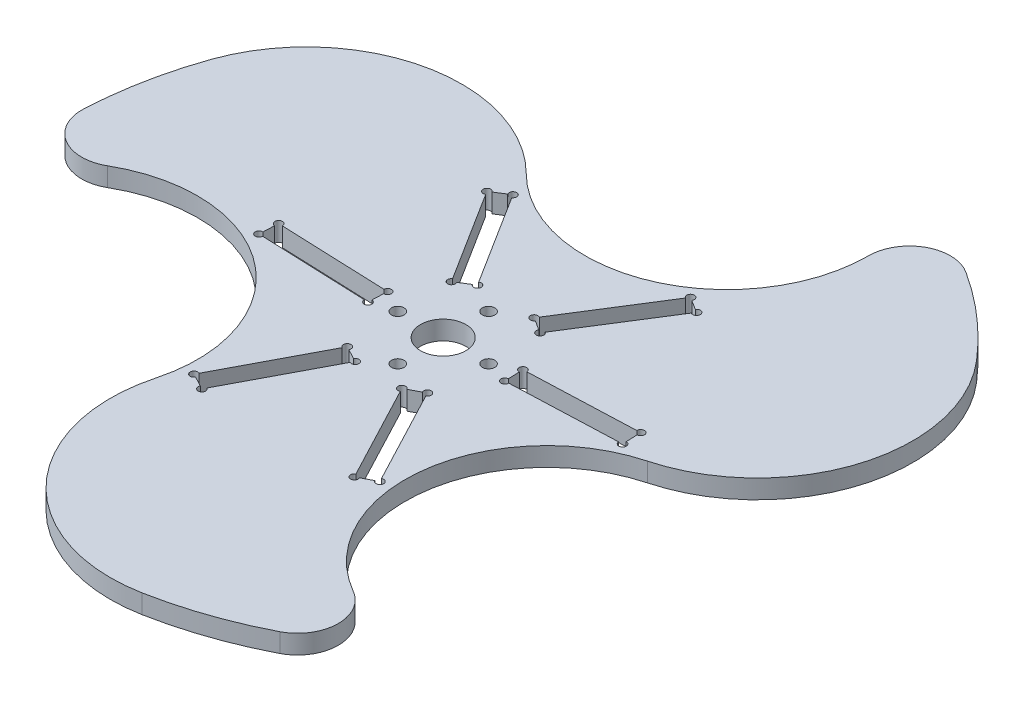
from build123d import *

# Parameters (mm, degrees)
SKETCH_1_R               = 6
EXTRUDE_1_DEPTH          = 5
CUT_EXTRUDE_1_DEPTH      = 142.435598161
CUT_EXTRUDE_1_DEPTH_BACK = 142.435598161
HOLE_WIZARD_M4_1_D       = 3.3


with BuildPart() as part:
    # 草圖1 → 填料-伸長1 (new body)
    with BuildSketch(Plane(origin=(0, 0, 0), x_dir=(1, 0, 0), z_dir=(0, 1, 0))):
        with BuildLine():
            ThreePointArc((-37.5, 75), (-43.126028135, 84.477281753), (-54.140127389, 84.076433121))
            ThreePointArc((-54.140127389, 84.076433121), (-86.602540378, 50), (-99.882390637, 4.848509122))
            ThreePointArc((-99.882390637, 4.848509122), (-94.722486108, -4.890404948), (-83.701905284, -5.024047358))
            ThreePointArc((-83.701905284, -5.024047358), (-32.475952642, -18.75), (-46.201905284, -69.975952642))
            ThreePointArc((-46.201905284, -69.975952642), (-51.596457973, -79.586876805), (-45.742263248, -88.924942243))
            ThreePointArc((-45.742263248, -88.924942243), (0, -100), (45.742263248, -88.924942243))
            ThreePointArc((45.742263248, -88.924942243), (51.596457973, -79.586876805), (46.201905284, -69.975952642))
            ThreePointArc((46.201905284, -69.975952642), (32.475952642, -18.75), (83.701905284, -5.024047358))
            ThreePointArc((83.701905284, -5.024047358), (94.722486108, -4.890404948), (99.882390637, 4.848509122))
            ThreePointArc((99.882390637, 4.848509122), (86.602540378, 50), (54.140127389, 84.076433121))
            ThreePointArc((54.140127389, 84.076433121), (43.126028135, 84.477281753), (37.5, 75))
            ThreePointArc((37.5, 75), (0, 37.5), (-37.5, 75))
        make_face()
        Circle(SKETCH_1_R, mode=Mode.SUBTRACT)
    extrude(amount=-EXTRUDE_1_DEPTH)

    # 草圖5 → 除料-伸長1 (cut, two sides: drawn at the far end of the back side and taken through both)
    with BuildSketch(Plane(origin=(0, 0, 0), x_dir=(1, 0, 0), z_dir=(0, 1, 0)).offset(-CUT_EXTRUDE_1_DEPTH_BACK)):
        with BuildLine():
            ThreePointArc((11.064347285, -15.647051453), (10.894662658, -13.807100179), (9.713605786, -15.228127352))
            Line((9.713605786, -15.228127352), (7.059107385, -16.625853449))
            ThreePointArc((7.059107385, -16.625853449), (5.219156112, -16.795538076), (6.640183285, -17.976594949))
            Line((6.640183285, -17.976594949), (19.685626862, -42.75191335))
            ThreePointArc((19.685626862, -42.75191335), (19.855311489, -44.591864623), (21.036368361, -43.17083745))
            Line((21.036368361, -43.17083745), (23.690866761, -41.773111353))
            ThreePointArc((23.690866761, -41.773111353), (25.530818035, -41.603426726), (24.109790862, -40.422369854))
            Line((24.109790862, -40.422369854), (11.064347285, -15.647051453))
        make_face()
        with BuildLine():
            ThreePointArc((18.888279541, 3.237730064), (17.1549407, 3.877847259), (17.927965139, 2.199560401))
            Line((17.927965139, 2.199560401), (18.044748032, -0.798165697))
            ThreePointArc((18.044748032, -0.798165697), (17.404630837, -2.531504538), (19.082917695, -1.758480099))
            Line((19.082917695, -1.758480099), (47.061694605, -0.66850644))
            ThreePointArc((47.061694605, -0.66850644), (48.795033447, -1.308623635), (48.022009007, 0.369663223))
            Line((48.022009007, 0.369663223), (47.905226115, 3.367389321))
            ThreePointArc((47.905226115, 3.367389321), (48.54534331, 5.100728162), (46.867056452, 4.327703723))
            Line((46.867056452, 4.327703723), (18.888279541, 3.237730064))
        make_face()
        with BuildLine():
            ThreePointArc((-19.082917695, -1.758480099), (-17.404630837, -2.531504538), (-18.044748032, -0.798165697))
            Line((-18.044748032, -0.798165697), (-17.927965139, 2.199560401))
            ThreePointArc((-17.927965139, 2.199560401), (-17.1549407, 3.877847259), (-18.888279541, 3.237730064))
            Line((-18.888279541, 3.237730064), (-46.867056452, 4.327703723))
            ThreePointArc((-46.867056452, 4.327703723), (-48.54534331, 5.100728162), (-47.905226115, 3.367389321))
            Line((-47.905226115, 3.367389321), (-48.022009007, 0.369663223))
            ThreePointArc((-48.022009007, 0.369663223), (-48.795033447, -1.308623635), (-47.061694605, -0.66850644))
            Line((-47.061694605, -0.66850644), (-19.082917695, -1.758480099))
        make_face()
        with BuildLine():
            ThreePointArc((-6.640183285, -17.976594949), (-5.219156112, -16.795538076), (-7.059107385, -16.625853449))
            Line((-7.059107385, -16.625853449), (-9.713605786, -15.228127352))
            ThreePointArc((-9.713605786, -15.228127352), (-10.894662658, -13.807100179), (-11.064347285, -15.647051453))
            Line((-11.064347285, -15.647051453), (-24.109790862, -40.422369854))
            ThreePointArc((-24.109790862, -40.422369854), (-25.530818035, -41.603426726), (-23.690866761, -41.773111353))
            Line((-23.690866761, -41.773111353), (-21.036368361, -43.17083745))
            ThreePointArc((-21.036368361, -43.17083745), (-19.855311489, -44.591864623), (-19.685626862, -42.75191335))
            Line((-19.685626862, -42.75191335), (-6.640183285, -17.976594949))
        make_face()
        with BuildLine():
            ThreePointArc((8.01857041, 17.405531551), (6.509968178, 16.338604717), (8.331142246, 16.026293049))
            Line((8.331142246, 16.026293049), (10.868857754, 14.426293049))
            ThreePointArc((10.868857754, 14.426293049), (11.935784588, 12.917690817), (12.248096257, 14.738864885))
            Line((12.248096257, 14.738864885), (27.18142959, 38.424209627))
            ThreePointArc((27.18142959, 38.424209627), (28.690031822, 39.491136461), (26.868857754, 39.803448129))
            Line((26.868857754, 39.803448129), (24.331142246, 41.403448129))
            ThreePointArc((24.331142246, 41.403448129), (23.264215412, 42.912050361), (22.951903743, 41.090876293))
            Line((22.951903743, 41.090876293), (8.01857041, 17.405531551))
        make_face()
        with BuildLine():
            ThreePointArc((-12.248096257, 14.738864885), (-11.935784588, 12.917690817), (-10.868857754, 14.426293049))
            Line((-10.868857754, 14.426293049), (-8.331142246, 16.026293049))
            ThreePointArc((-8.331142246, 16.026293049), (-6.509968178, 16.338604717), (-8.01857041, 17.405531551))
            Line((-8.01857041, 17.405531551), (-22.951903743, 41.090876293))
            ThreePointArc((-22.951903743, 41.090876293), (-23.264215412, 42.912050361), (-24.331142246, 41.403448129))
            Line((-24.331142246, 41.403448129), (-26.868857754, 39.803448129))
            ThreePointArc((-26.868857754, 39.803448129), (-28.690031822, 39.491136461), (-27.18142959, 38.424209627))
            Line((-27.18142959, 38.424209627), (-12.248096257, 14.738864885))
        make_face()
        with BuildLine():
            ThreePointArc((-54.140127389, 84.076433121), (-78.549718093, 61.886523473), (-94.411369737, 32.961997276))
            ThreePointArc((-94.411369737, 32.961997276), (-64.754920057, 59.492565497), (-26.516504294, 48.483495706))
            ThreePointArc((-26.516504294, 48.483495706), (-34.645482469, 60.649371286), (-37.5, 75))
            ThreePointArc((-37.5, 75), (-43.126028135, 84.477281753), (-54.140127389, 84.076433121))
        make_face()
        with BuildLine():
            ThreePointArc((99.882390637, 4.848509122), (92.870160526, 37.082789592), (75.751611869, 65.28164596))
            ThreePointArc((75.751611869, 65.28164596), (83.899533086, 26.333123041), (55.246191092, -1.277781514))
            ThreePointArc((55.246191092, -1.277781514), (69.846637492, -0.320817698), (83.701905284, -5.024047358))
            ThreePointArc((83.701905284, -5.024047358), (94.722486108, -4.890404948), (99.882390637, 4.848509122))
        make_face()
        with BuildLine():
            ThreePointArc((-45.742263248, -88.924942243), (-14.320442433, -98.969313065), (18.659757868, -98.243643236))
            ThreePointArc((18.659757868, -98.243643236), (-19.144613028, -85.825688538), (-28.729686798, -47.205714191))
            ThreePointArc((-28.729686798, -47.205714191), (-35.201155023, -60.328553588), (-46.201905284, -69.975952642))
            ThreePointArc((-46.201905284, -69.975952642), (-51.596457973, -79.586876805), (-45.742263248, -88.924942243))
        make_face()
    extrude(amount=CUT_EXTRUDE_1_DEPTH + CUT_EXTRUDE_1_DEPTH_BACK, mode=Mode.SUBTRACT)

    # M4  螺絲攻的螺孔鑽1 (through all)
    with Locations(Plane(origin=(0, 0, 0), x_dir=(1, 0, 0), z_dir=(0, 1, 0))):
        with Locations((0, 12), (12, 0), (0, -12), (-12, 0)):
            Hole(HOLE_WIZARD_M4_1_D / 2)


solid = part.part
